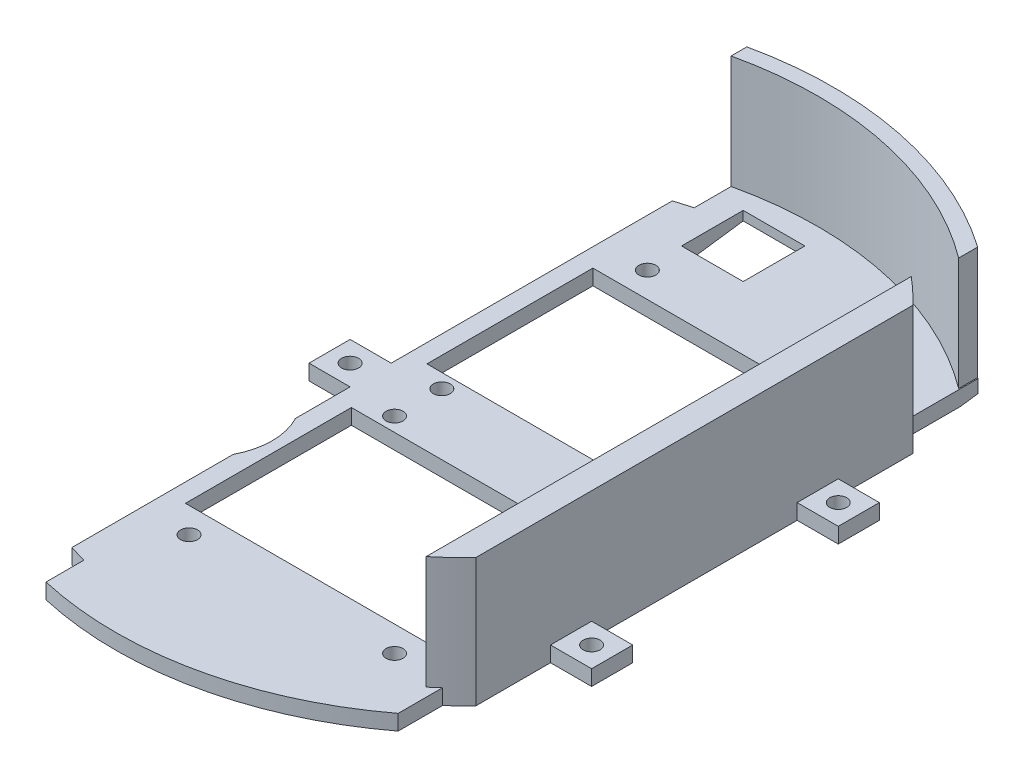
from build123d import *

# Parameters (mm, degrees)
SKETCH1_W               = 8
SKETCH1_H               = 8
SKETCH1_R               = 1.65
BOSS_EXTRUDE1_DEPTH     = 3
BOSS_EXTRUDE2_DEPTH     = 22
SKETCH3_R               = 13
CUT_EXTRUDE1_DEPTH      = 92.431135288
CUT_EXTRUDE3_DEPTH      = 3
SKETCH6_R               = 1.65
SKETCH6_W               = 51.3
SKETCH6_H               = 32.3
CUT_EXTRUDE4_DEPTH      = 93.198983183
BOSS_EXTRUDE4_DEPTH     = 25
CUT_EXTRUDE5_DEPTH      = 93.198983183
SKETCH10_W              = 12
SKETCH10_H              = 12
CUT_EXTRUDE6_DEPTH      = 93.198983183
SKETCH11_W              = 5
SKETCH11_H              = 5
CUT_EXTRUDE7_DEPTH      = 10
CUT_EXTRUDE8_DEPTH      = 93.198983183
CUT_EXTRUDE8_DEPTH_BACK = 93.198983183


# Read off the part's stored shape, not the designer's step: Cut-Extrude3
with BuildPart() as part:
    # Sketch1 → Boss-Extrude1 (new body)
    # profile 1 of 4: a face of its own
    with BuildSketch(Plane(origin=(0, 0, 0), x_dir=(1, 0, 0), z_dir=(0, 1, 0))):
        with BuildLine():
            Line((-18.5, 69.116947994), (-18.5, 4))
            Line((-18.5, 4), (-18.5, -4))
            Line((-18.5, -4), (-18.5, -65.642897559))
            ThreePointArc((-18.5, -65.642897559), (14.755653403, -66.584613032), (44.5, -51.681621492))
            Line((44.5, -51.681621492), (44.5, -28))
            Line((44.5, -28), (44.5, -20))
            Line((44.5, -20), (44.5, 20))
            Line((44.5, 20), (44.5, 28))
            Line((44.5, 28), (44.5, 55))
            Line((44.5, 55), (44.5, 56.028140251))
            ThreePointArc((44.5, 56.028140251), (14.554354058, 70.054073957), (-18.5, 69.116947994))
        make_face()
    # profile 2 of 4: a face of its own
    with BuildSketch(Plane(origin=(0, 0, 0), x_dir=(1, 0, 0), z_dir=(0, 1, 0))):
        with Locations((-22.5, 0)):
            Rectangle(SKETCH1_W, SKETCH1_H)
        with Locations(Location((-22.5, 0, 0), (0, 0, 270))):
            Circle(SKETCH1_R, mode=Mode.SUBTRACT)
    # profile 3 of 4: a face of its own
    with BuildSketch(Plane(origin=(0, 0, 0), x_dir=(1, 0, 0), z_dir=(0, 1, 0))):
        with Locations((48.5, -24)):
            Rectangle(SKETCH1_W, SKETCH1_H)
        with Locations(Location((48.5, -24, 0), (0, 0, 270))):
            Circle(SKETCH1_R, mode=Mode.SUBTRACT)
    # profile 4 of 4: a face of its own
    with BuildSketch(Plane(origin=(0, 0, 0), x_dir=(1, 0, 0), z_dir=(0, 1, 0))):
        with Locations((48.5, 24)):
            Rectangle(SKETCH1_W, SKETCH1_H)
        with Locations(Location((48.5, 24, 0), (0, 0, 270))):
            Circle(SKETCH1_R, mode=Mode.SUBTRACT)
    extrude(amount=BOSS_EXTRUDE1_DEPTH)

    # Sketch2 → Boss-Extrude2 (add)
    with BuildSketch(Plane(origin=(0, 3, 0), x_dir=(1, 0, 0), z_dir=(0, 1, 0))):
        with BuildLine():
            Line((44.5, -42.522376462), (44.5, 42.522376462))
            ThreePointArc((44.5, 42.522376462), (42.065161183, 44.932446124), (39.5, 47.203310265))
            Line((39.5, 47.203310265), (39.5, -47.203310265))
            ThreePointArc((39.5, -47.203310265), (42.065161183, -44.932446124), (44.5, -42.522376462))
        make_face()
    extrude(amount=BOSS_EXTRUDE2_DEPTH)

    # Sketch3 → Cut-Extrude1 (cut, through all)
    with BuildSketch(Plane(origin=(0, 3, 0), x_dir=(1, 0, 0), z_dir=(0, 1, 0))):
        with Locations((-30, -20.7)):
            Circle(SKETCH3_R)
    extrude(amount=-CUT_EXTRUDE1_DEPTH, mode=Mode.SUBTRACT)

    # Cut-Extrude3 outline → Cut-Extrude3 (cut)
    with BuildSketch(Plane(origin=(0, 0, 0), x_dir=(1, 0, 0), z_dir=(0, 1, 0))):
        with BuildLine():
            Line((44.5, -51.681621492), (44.5, -42.522376462))
            ThreePointArc((44.5, -42.522376462), (42.879948374, -44.155549226), (41.2, -45.727043421))
            Line((41.2, -45.727043421), (41.2, -54.348873033))
            ThreePointArc((41.2, -54.348873033), (42.870748276, -53.040917623), (44.5, -51.681621492))
        make_face()
        with BuildLine():
            ThreePointArc((41.2, 45.727043421), (42.879948374, 44.155549226), (44.5, 42.522376462))
            Line((44.5, 42.522376462), (44.5, 56.028140251))
            ThreePointArc((44.5, 56.028140251), (42.867784957, 57.286608495), (41.2, 58.497542683))
            Line((41.2, 58.497542683), (41.2, 45.727043421))
        make_face()
        with BuildLine():
            ThreePointArc((-18.5, -65.642897559), (-16.85525465, -66.084343007), (-15.2, -66.484584679))
            Line((-15.2, -66.484584679), (-15.2, -59.091509852))
            ThreePointArc((-15.2, -59.091509852), (-16.856674237, -58.640421812), (-18.5, -58.142897559))
            Line((-18.5, -58.142897559), (-18.5, -65.642897559))
        make_face()
    extrude(amount=CUT_EXTRUDE3_DEPTH, mode=Mode.SUBTRACT)

    # Sketch6 → Cut-Extrude4 (cut, through all)
    with BuildSketch(Plane(origin=(0, 0, 0), x_dir=(1, 0, 0), z_dir=(0, 1, 0))):
        with Locations(Location((-9.25, 44.6, 0), (0, 0, 90))):
            Circle(SKETCH6_R)
        with Locations(Location((-9.25, 4.6, 0), (0, 0, 90))):
            Circle(SKETCH6_R)
        with Locations(Location((30.75, 4.6, 0), (0, 0, 90))):
            Circle(SKETCH6_R)
        with Locations(Location((30.75, 44.6, 0), (0, 0, 90))):
            Circle(SKETCH6_R)
        with Locations(Location((-9.25, -4.6, 0), (0, 0, 90))):
            Circle(SKETCH6_R)
        with Locations(Location((30.75, -4.6, 0), (0, 0, 90))):
            Circle(SKETCH6_R)
        with Locations(Location((30.75, -44.6, 0), (0, 0, 90))):
            Circle(SKETCH6_R)
        with Locations(Location((-9.25, -44.6, 0), (0, 0, 90))):
            Circle(SKETCH6_R)
        with Locations((10.75, 23.5)):
            Rectangle(SKETCH6_W, SKETCH6_H)
        with Locations((10.75, -23.5)):
            Rectangle(SKETCH6_W, SKETCH6_H)
    extrude(amount=CUT_EXTRUDE4_DEPTH, mode=Mode.SUBTRACT)

    # Sketch8 → Boss-Extrude4 (add)
    with BuildSketch(Plane(origin=(0, 0, 0), x_dir=(1, 0, 0), z_dir=(0, 1, 0))):
        with BuildLine():
            Line((41, 58.637893039), (41, 54.93725967))
            ThreePointArc((41, 54.93725967), (14.207393879, 67.061557238), (-15.2, 66.843567379))
            Line((-15.2, 66.843567379), (-15.2, 69.916825586))
            ThreePointArc((-15.2, 69.916825586), (14.078834464, 70.151186164), (41, 58.637893039))
        make_face()
    extrude(amount=BOSS_EXTRUDE4_DEPTH)

    # Sketch9 → Cut-Extrude5 (cut, through all)
    with BuildSketch(Plane(origin=(0, 0, 0), x_dir=(1, 0, 0), z_dir=(0, 1, 0))):
        with BuildLine():
            Line((-18.5, 58.703939391), (-18.5, 74.933190401))
            Line((-18.5, 74.933190401), (-15.2, 74.933190401))
            Line((-15.2, 74.933190401), (-15.2, 59.643629165))
            ThreePointArc((-15.2, 59.643629165), (-16.856549297, 59.196784083), (-18.5, 58.703939391))
        make_face()
    extrude(amount=CUT_EXTRUDE5_DEPTH, mode=Mode.SUBTRACT)

    # Sketch10 → Cut-Extrude6 (cut, through all)
    with BuildSketch(Plane(origin=(0, 0, 0), x_dir=(1, 0, 0), z_dir=(0, 1, 0))):
        with Locations((-4, 58)):
            Rectangle(SKETCH10_W, SKETCH10_H)
    extrude(amount=CUT_EXTRUDE6_DEPTH, mode=Mode.SUBTRACT)

    # Sketch11 → Cut-Extrude7 (cut)
    with BuildSketch(Plane(origin=(0, 3, 0), x_dir=(1, 0, 0), z_dir=(0, 1, 0))):
        with Locations((37, 0)):
            Rectangle(SKETCH11_W, SKETCH11_H)
    extrude(amount=-CUT_EXTRUDE7_DEPTH, mode=Mode.SUBTRACT)

    # Sketch13 → Cut-Extrude8 (cut, two sides: drawn at the far end of the back side and taken through both)
    with BuildSketch(Plane(origin=(0, 0, 0), x_dir=(0, 0, -1), z_dir=(1, 0, 0)).offset(-CUT_EXTRUDE8_DEPTH_BACK)):
        Polygon((55.086575096, 0), (71.55, 2.244157451), (71.55, 0), align=None)
    extrude(amount=CUT_EXTRUDE8_DEPTH + CUT_EXTRUDE8_DEPTH_BACK, mode=Mode.SUBTRACT)


solid = part.part
